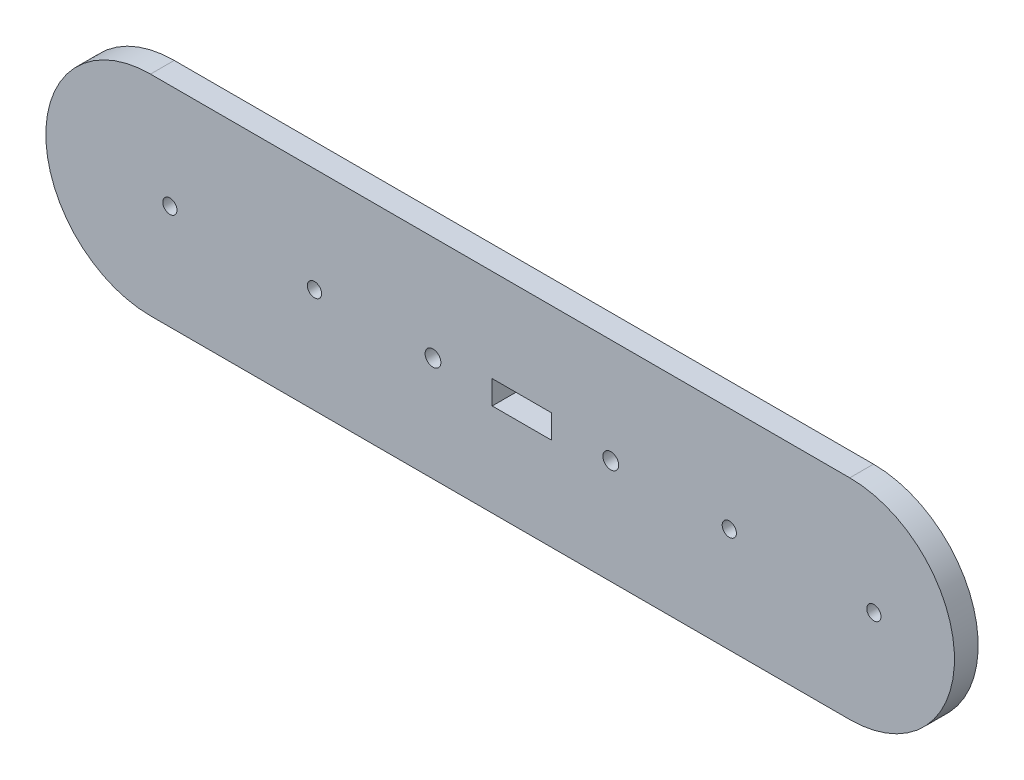
from build123d import *

# Parameters (mm, degrees)
ESBO_O1_R                = 2
ESBO_O1_R_2              = 1.8
ESBO_O1_W                = 15
ESBO_O1_H                = 6
RESSALTO_EXTRUS_O1_DEPTH = 6


with BuildPart() as part:
    # Esboço1 → Ressalto-extrusão1 (new body)
    with BuildSketch(Plane.XY):
        with BuildLine():
            Line((-94, 26.5), (83, 26.5))
            ThreePointArc((83, 26.5), (109.5, 0), (83, -26.5))
            Line((83, -26.5), (-94, -26.5))
            ThreePointArc((-94, -26.5), (-120.5, 0), (-94, 26.5))
        make_face()
        with Locations((-22.5, 0)):
            Circle(ESBO_O1_R, mode=Mode.SUBTRACT)
        with Locations((22.5, 0)):
            Circle(ESBO_O1_R, mode=Mode.SUBTRACT)
        with Locations((-89.1, 0)):
            Circle(ESBO_O1_R_2, mode=Mode.SUBTRACT)
        with Locations((-52.5, 0)):
            Circle(ESBO_O1_R_2, mode=Mode.SUBTRACT)
        with Locations((52.5, 0)):
            Circle(ESBO_O1_R_2, mode=Mode.SUBTRACT)
        with Locations((89.1, 0)):
            Circle(ESBO_O1_R_2, mode=Mode.SUBTRACT)
        Rectangle(ESBO_O1_W, ESBO_O1_H, mode=Mode.SUBTRACT)
    extrude(amount=RESSALTO_EXTRUS_O1_DEPTH)


solid = part.part
